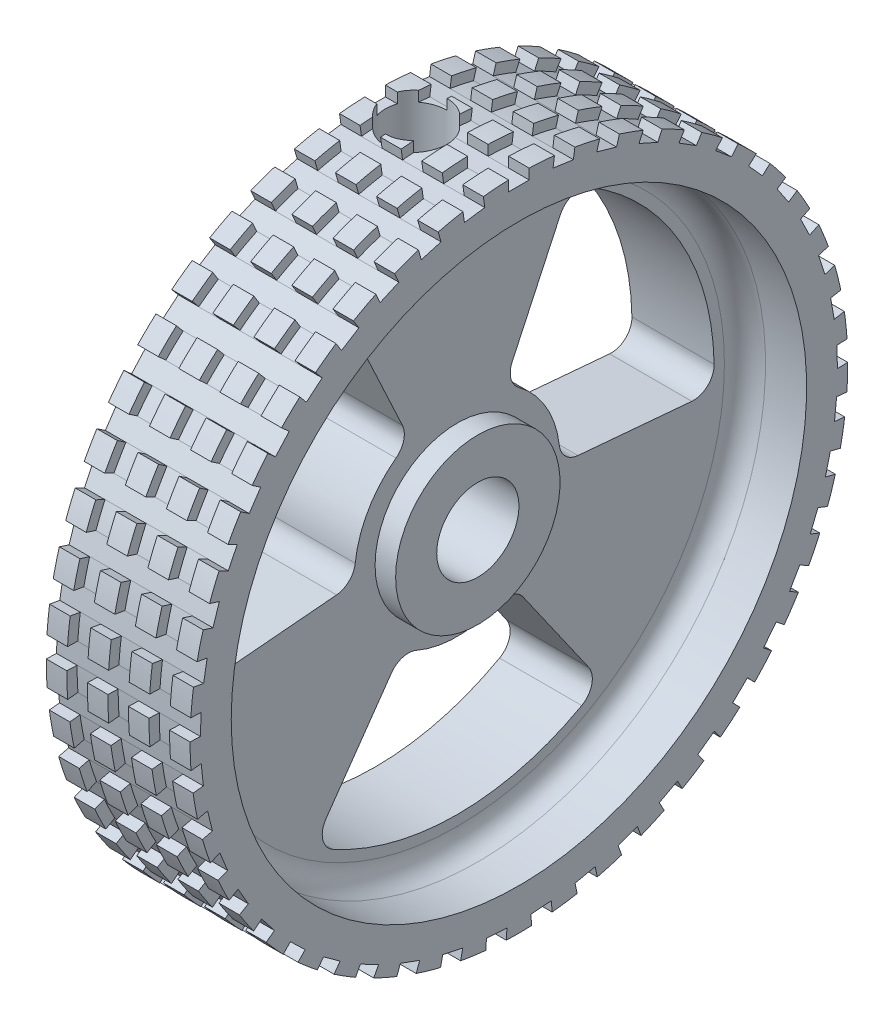
from build123d import *

# Parameters (mm, degrees)
CUT_EXTRUDE3_DEPTH       = 23.978250743
FILLET1_R                = 1
CIRPATTERN1_COUNT        = 3
FILLET1_OF_CIRPATTERN1_R = 1
FILLET2_R                = 1
SKETCH6_W                = 1
SKETCH6_H                = 0.5
CUT_EXTRUDE4_DEPTH       = 24.685438729
CIRPATTERN2_COUNT        = 45
LPATTERN1_COUNT          = 3
LPATTERN1_PITCH          = 2


with BuildPart() as part:
    # Sketch1 → Revolve1 (revolve)
    with BuildSketch(Plane.XY):
        Polygon((0, 2), (5, 2), (5, 4), (4, 4), (4, 14), (7, 14), (7, 16), (0, 16), align=None)
    revolve(axis=Axis((0, 0, 0), (1, 0, 0)))

    # Sketch2 → Cut-Revolve3 (revolve, cut)
    with BuildSketch(Plane.XY):
        Polygon((2, 16), (3.5, 16), (3.5, 11.5), (2.9, 11.5), (2.9, 0), (2, 0), align=None)
    revolve(axis=Axis((2, 0, 0), (0, 1, 0)), mode=Mode.SUBTRACT)

    # Sketch3 → Cut-Extrude3 (cut, through all)
    with BuildSketch(Plane(origin=(4, 0, 0), x_dir=(0, 0, -1), z_dir=(1, 0, 0))):
        with BuildLine():
            Line((-2.696715574, -4.210430514), (-7, -10.356157589))
            ThreePointArc((-7, -10.356157589), (0, -12.5), (7, -10.356157589))
            Line((7, -10.356157589), (2.696715574, -4.210430514))
            ThreePointArc((2.696715574, -4.210430514), (0, -5), (-2.696715574, -4.210430514))
        make_face()
    cut_extrude3 = extrude(amount=-CUT_EXTRUDE3_DEPTH, mode=Mode.SUBTRACT)

    # Fillet1
    fillet1_edges = [part.edges().sort_by_distance(p)[0] for p in [
        (2, -10.356157589, 7),
        (2, -4.210430514, 2.696715574),
        (2, -4.210430514, -2.696715574),
        (2, -10.356157589, -7),
    ]]
    fillet(fillet1_edges, radius=FILLET1_R)

    # CirPattern1: Cut-Extrude3 ×3 about axis
    cirpattern1_axis = Axis((0, 0, 0), (-1, 0, 0))
    for i in range(1, CIRPATTERN1_COUNT):
        add(cut_extrude3.rotate(cirpattern1_axis, i * 360 / CIRPATTERN1_COUNT), mode=Mode.SUBTRACT)

    # Fillet1 of CirPattern1
    fillet1_of_cirpattern1_edges = [part.edges().sort_by_distance(p)[0] for p in [
        (2, 11.240256621, 5.468695557),
        (2, 4.440639451, 2.297981999),
        (2, -0.230208937, 4.994697573),
        (2, -0.884099032, 12.468695557),
        (2, -0.884099032, -12.468695557),
        (2, -0.230208937, -4.994697573),
        (2, 4.440639451, -2.297981999),
        (2, 11.240256621, -5.468695557),
    ]]
    fillet(fillet1_of_cirpattern1_edges, radius=FILLET1_OF_CIRPATTERN1_R)

    # Fillet2
    fillet2_edges = [part.edges().sort_by_distance(p)[0] for p in [
        (4, -14, 0),
    ]]
    fillet(fillet2_edges, radius=FILLET2_R)

    # Sketch6 → Cut-Revolve4 (revolve, cut)
    with BuildSketch(Plane.XY):
        with Locations((5.5, 15.75)):
            Rectangle(SKETCH6_W, SKETCH6_H)
    cut_revolve4 = revolve(axis=Axis((0, 0, 0), (1, 0, 0)), mode=Mode.SUBTRACT)

    # Sketch5 → Cut-Extrude4 (cut, through all)
    with BuildSketch(Plane(origin=(7, 0, 0), x_dir=(0, 0, -1), z_dir=(1, 0, 0))):
        with BuildLine():
            Line((-0.5, 15.992185592), (-0.5, 15.492185592))
            Line((-0.5, 15.492185592), (0.5, 15.492185592))
            Line((0.5, 15.492185592), (0.5, 15.992185592))
            ThreePointArc((0.5, 15.992185592), (0, 16), (-0.5, 15.992185592))
        make_face()
    cut_extrude4 = extrude(amount=-CUT_EXTRUDE4_DEPTH, mode=Mode.SUBTRACT)

    # CirPattern2: Cut-Extrude4 ×45 about axis
    cirpattern2_axis = Axis((0, 0, 0), (-1, 0, 0))
    for i in range(1, CIRPATTERN2_COUNT):
        add(cut_extrude4.rotate(cirpattern2_axis, i * 360 / CIRPATTERN2_COUNT), mode=Mode.SUBTRACT)

    # LPattern1: Cut-Revolve4 ×3
    with Locations(*[(-i * LPATTERN1_PITCH, 0, 0) for i in range(1, LPATTERN1_COUNT)]):
        add(cut_revolve4, mode=Mode.SUBTRACT)


solid = part.part
